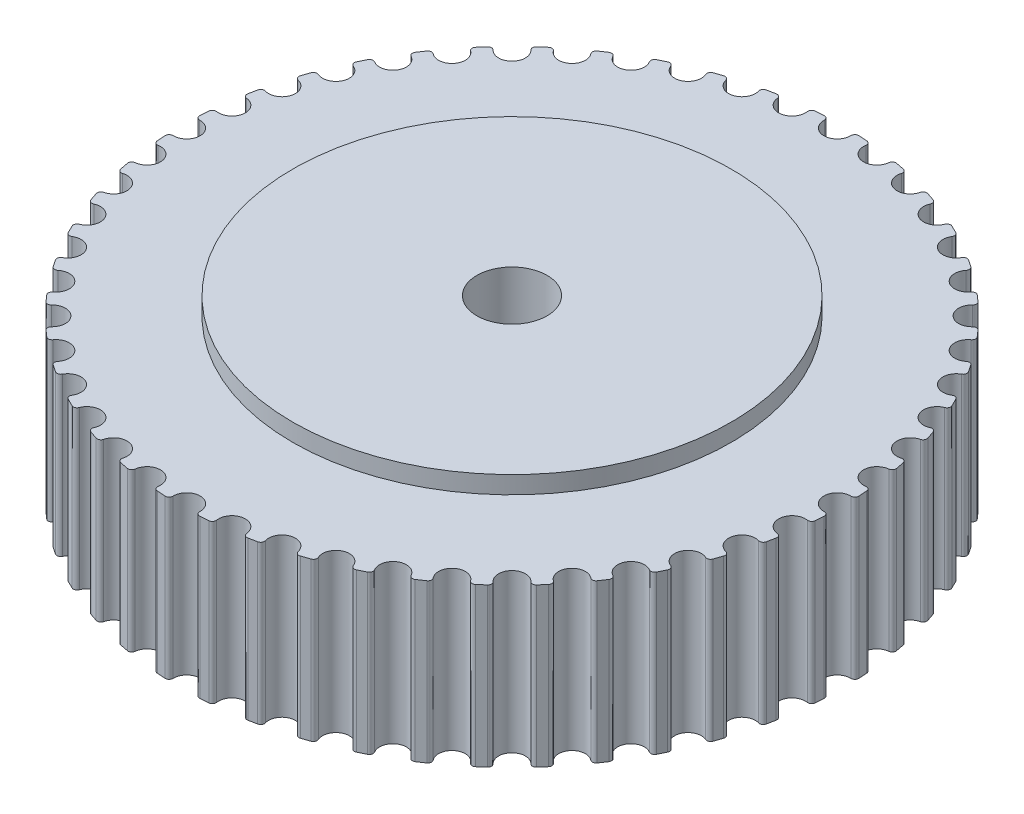
from build123d import *

# Parameters (mm, degrees)
AUFSATZ_LINEAR_AUSTRAGEN1_DEPTH = 18
SKIZZE5_R                       = 25
AUFSATZ_LINEAR_AUSTRAGEN2_DEPTH = 2
F_8_0_8_DURCHMESSER_BOHRUNG1_D  = 8
KREISMUSTER1_COUNT              = 3


with BuildPart() as part:
    # Skizze1 → Aufsatz-Linear austragen1 (new body)
    with BuildSketch(Plane(origin=(0, 0, 0), x_dir=(1, 0, 0), z_dir=(0, 1, 0))):
        with BuildLine():
            Line((1.98238775, 37.572704303), (2.938793876, 37.510018134))
            ThreePointArc((2.938793876, 37.510018134), (3.246775364, 37.349143087), (3.335291888, 37.013139809))
            ThreePointArc((3.335291888, 37.013139809), (3.618732929, 35.861010692), (4.642164026, 35.260736495))
            ThreePointArc((4.642164026, 35.260736495), (5.78608495, 35.575673386), (6.358060929, 36.615184715))
            ThreePointArc((6.358060929, 36.615184715), (6.530525373, 36.916829196), (6.869650172, 36.992511085))
            Line((6.869650172, 36.992511085), (7.809691924, 36.805525155))
            ThreePointArc((7.809691924, 36.805525155), (8.09404018, 36.605826765), (8.137942205, 36.261144317))
            ThreePointArc((8.137942205, 36.261144317), (8.268575342, 35.081875345), (9.204899339, 34.353152012))
            ThreePointArc((9.204899339, 34.353152012), (10.380141373, 34.516082932), (11.082907474, 35.472043251))
            ThreePointArc((11.082907474, 35.472043251), (11.293268967, 35.748595995), (11.639370975, 35.779365746))
            Line((11.639370975, 35.779365746), (12.546963978, 35.471279435))
            ThreePointArc((12.546963978, 35.471279435), (12.802813725, 35.236174598), (12.801350074, 34.888710592))
            ThreePointArc((12.801350074, 34.888710592), (12.776940138, 33.702479384), (13.610136272, 32.857775574))
            ThreePointArc((13.610136272, 32.857775574), (14.7965907, 32.865912729), (15.6181224, 33.721965292))
            ThreePointArc((15.6181224, 33.721965292), (15.862781598, 33.968694404), (16.209938914, 33.954025538))
            Line((16.209938914, 33.954025538), (17.069554, 33.530110291))
            ThreePointArc((17.069554, 33.530110291), (17.292527578, 33.263621714), (17.245723295, 32.919321356))
            ThreePointArc((17.245723295, 32.919321356), (17.066687946, 31.746424656), (17.7825, 30.800193486))
            ThreePointArc((17.7825, 30.800193486), (18.959866258, 30.653397648), (19.886106922, 31.394895158))
            ThreePointArc((19.886106922, 31.394895158), (20.160877638, 31.607579035), (20.503150303, 31.54772254))
            Line((20.503150303, 31.54772254), (21.30007922, 31.015231662))
            ThreePointArc((21.30007922, 31.015231662), (21.486361489, 30.721919041), (21.395017408, 30.386673404))
            ThreePointArc((21.395017408, 30.386673404), (21.064419992, 29.247179801), (21.650600223, 28.215611547))
            ThreePointArc((21.650600223, 28.215611547), (22.798733248, 27.916394434), (23.813834641, 28.530649663))
            ThreePointArc((23.813834641, 28.530649663), (24.114015471, 28.705649225), (24.445547107, 28.601629263))
            Line((24.445547107, 28.601629263), (25.166154179, 27.969673821))
            ThreePointArc((25.166154179, 27.969673821), (25.312557798, 27.654555815), (25.178236842, 27.334101046))
            ThreePointArc((25.178236842, 27.334101046), (24.701733971, 26.24750759), (25.148252673, 25.148252673))
            ThreePointArc((25.148252673, 25.148252673), (26.24750759, 24.701733971), (27.334101046, 25.178236842))
            ThreePointArc((27.334101046, 25.178236842), (27.654555815, 25.312557798), (27.969673821, 25.166154179))
            Line((27.969673821, 25.166154179), (28.601629263, 24.445547107))
            ThreePointArc((28.601629263, 24.445547107), (28.705649225, 24.114015471), (28.530649663, 23.813834641))
            ThreePointArc((28.530649663, 23.813834641), (27.916394434, 22.798733248), (28.215611547, 21.650600223))
            ThreePointArc((28.215611547, 21.650600223), (29.247179801, 21.064419992), (30.386673404, 21.395017408))
            ThreePointArc((30.386673404, 21.395017408), (30.721919041, 21.486361489), (31.015231662, 21.30007922))
            Line((31.015231662, 21.30007922), (31.54772254, 20.503150303))
            ThreePointArc((31.54772254, 20.503150303), (31.607579035, 20.160877638), (31.394895158, 19.886106922))
            ThreePointArc((31.394895158, 19.886106922), (30.653397648, 18.959866258), (30.800193486, 17.7825))
            ThreePointArc((30.800193486, 17.7825), (31.746424656, 17.066687946), (32.919321356, 17.245723295))
            ThreePointArc((32.919321356, 17.245723295), (33.263621714, 17.292527578), (33.530110291, 17.069554))
            Line((33.530110291, 17.069554), (33.954025538, 16.209938914))
            ThreePointArc((33.954025538, 16.209938914), (33.968694404, 15.862781598), (33.721965292, 15.6181224))
            ThreePointArc((33.721965292, 15.6181224), (32.865912729, 14.7965907), (32.857775574, 13.610136272))
            ThreePointArc((32.857775574, 13.610136272), (33.702479384, 12.776940138), (34.888710592, 12.801350074))
            ThreePointArc((34.888710592, 12.801350074), (35.236174598, 12.802813725), (35.471279435, 12.546963978))
            Line((35.471279435, 12.546963978), (35.779365746, 11.639370975))
            ThreePointArc((35.779365746, 11.639370975), (35.748595995, 11.293268967), (35.472043251, 11.082907474))
            ThreePointArc((35.472043251, 11.082907474), (34.516082932, 10.380141373), (34.353152012, 9.204899339))
            ThreePointArc((34.353152012, 9.204899339), (35.081875345, 8.268575342), (36.261144317, 8.137942205))
            ThreePointArc((36.261144317, 8.137942205), (36.605826765, 8.09404018), (36.805525155, 7.809691924))
            Line((36.805525155, 7.809691924), (36.992511085, 6.869650172))
            ThreePointArc((36.992511085, 6.869650172), (36.916829196, 6.530525373), (36.615184715, 6.358060929))
            ThreePointArc((36.615184715, 6.358060929), (35.575673386, 5.78608495), (35.260736495, 4.642164026))
            ThreePointArc((35.260736495, 4.642164026), (35.861010692, 3.618732929), (37.013139809, 3.335291888))
            ThreePointArc((37.013139809, 3.335291888), (37.349143087, 3.246775364), (37.510018134, 2.938793876))
            Line((37.510018134, 2.938793876), (37.572704303, 1.98238775))
            ThreePointArc((37.572704303, 1.98238775), (37.453405215, 1.656042679), (37.131830217, 1.524426198))
            ThreePointArc((37.131830217, 1.524426198), (36.026554205, 1.093027008), (35.565, 0))
            ThreePointArc((35.565, 0), (36.026554205, -1.093027008), (37.131830217, -1.524426198))
            ThreePointArc((37.131830217, -1.524426198), (37.453405215, -1.656042679), (37.572704303, -1.98238775))
            Line((37.572704303, -1.98238775), (37.510018134, -2.938793876))
            ThreePointArc((37.510018134, -2.938793876), (37.349143087, -3.246775364), (37.013139809, -3.335291888))
            ThreePointArc((37.013139809, -3.335291888), (35.861010692, -3.618732929), (35.260736495, -4.642164026))
            ThreePointArc((35.260736495, -4.642164026), (35.575673386, -5.78608495), (36.615184715, -6.358060929))
            ThreePointArc((36.615184715, -6.358060929), (36.916829196, -6.530525373), (36.992511085, -6.869650172))
            Line((36.992511085, -6.869650172), (36.805525155, -7.809691924))
            ThreePointArc((36.805525155, -7.809691924), (36.605826765, -8.09404018), (36.261144317, -8.137942205))
            ThreePointArc((36.261144317, -8.137942205), (35.081875345, -8.268575342), (34.353152012, -9.204899339))
            ThreePointArc((34.353152012, -9.204899339), (34.516082932, -10.380141373), (35.472043251, -11.082907474))
            ThreePointArc((35.472043251, -11.082907474), (35.748595995, -11.293268967), (35.779365746, -11.639370975))
            Line((35.779365746, -11.639370975), (35.471279435, -12.546963978))
            ThreePointArc((35.471279435, -12.546963978), (35.236174598, -12.802813725), (34.888710592, -12.801350074))
            ThreePointArc((34.888710592, -12.801350074), (33.702479384, -12.776940138), (32.857775574, -13.610136272))
            ThreePointArc((32.857775574, -13.610136272), (32.865912729, -14.7965907), (33.721965292, -15.6181224))
            ThreePointArc((33.721965292, -15.6181224), (33.968694404, -15.862781598), (33.954025538, -16.209938914))
            Line((33.954025538, -16.209938914), (33.530110291, -17.069554))
            ThreePointArc((33.530110291, -17.069554), (33.263621714, -17.292527578), (32.919321356, -17.245723295))
            ThreePointArc((32.919321356, -17.245723295), (31.746424656, -17.066687946), (30.800193486, -17.7825))
            ThreePointArc((30.800193486, -17.7825), (30.653397648, -18.959866258), (31.394895158, -19.886106922))
            ThreePointArc((31.394895158, -19.886106922), (31.607579035, -20.160877638), (31.54772254, -20.503150303))
            Line((31.54772254, -20.503150303), (31.015231662, -21.30007922))
            ThreePointArc((31.015231662, -21.30007922), (30.721919041, -21.486361489), (30.386673404, -21.395017408))
            ThreePointArc((30.386673404, -21.395017408), (29.247179801, -21.064419992), (28.215611547, -21.650600223))
            ThreePointArc((28.215611547, -21.650600223), (27.916394434, -22.798733248), (28.530649663, -23.813834641))
            ThreePointArc((28.530649663, -23.813834641), (28.705649225, -24.114015471), (28.601629263, -24.445547107))
            Line((28.601629263, -24.445547107), (27.969673821, -25.166154179))
            ThreePointArc((27.969673821, -25.166154179), (27.654555815, -25.312557798), (27.334101046, -25.178236842))
            ThreePointArc((27.334101046, -25.178236842), (26.24750759, -24.701733971), (25.148252673, -25.148252673))
            ThreePointArc((25.148252673, -25.148252673), (24.701733971, -26.24750759), (25.178236842, -27.334101046))
            ThreePointArc((25.178236842, -27.334101046), (25.312557798, -27.654555815), (25.166154179, -27.969673821))
            Line((25.166154179, -27.969673821), (24.445547107, -28.601629263))
            ThreePointArc((24.445547107, -28.601629263), (24.114015471, -28.705649225), (23.813834641, -28.530649663))
            ThreePointArc((23.813834641, -28.530649663), (22.798733248, -27.916394434), (21.650600223, -28.215611547))
            ThreePointArc((21.650600223, -28.215611547), (21.064419992, -29.247179801), (21.395017408, -30.386673404))
            ThreePointArc((21.395017408, -30.386673404), (21.486361489, -30.721919041), (21.30007922, -31.015231662))
            Line((21.30007922, -31.015231662), (20.503150303, -31.54772254))
            ThreePointArc((20.503150303, -31.54772254), (20.160877638, -31.607579035), (19.886106922, -31.394895158))
            ThreePointArc((19.886106922, -31.394895158), (18.959866258, -30.653397648), (17.7825, -30.800193486))
            ThreePointArc((17.7825, -30.800193486), (17.066687946, -31.746424656), (17.245723295, -32.919321356))
            ThreePointArc((17.245723295, -32.919321356), (17.292527578, -33.263621714), (17.069554, -33.530110291))
            Line((17.069554, -33.530110291), (16.209938914, -33.954025538))
            ThreePointArc((16.209938914, -33.954025538), (15.862781598, -33.968694404), (15.6181224, -33.721965292))
            ThreePointArc((15.6181224, -33.721965292), (14.7965907, -32.865912729), (13.610136272, -32.857775574))
            ThreePointArc((13.610136272, -32.857775574), (12.776940138, -33.702479384), (12.801350074, -34.888710592))
            ThreePointArc((12.801350074, -34.888710592), (12.802813725, -35.236174598), (12.546963978, -35.471279435))
            Line((12.546963978, -35.471279435), (11.639370975, -35.779365746))
            ThreePointArc((11.639370975, -35.779365746), (11.293268967, -35.748595995), (11.082907474, -35.472043251))
            ThreePointArc((11.082907474, -35.472043251), (10.380141373, -34.516082932), (9.204899339, -34.353152012))
            ThreePointArc((9.204899339, -34.353152012), (8.268575342, -35.081875345), (8.137942205, -36.261144317))
            ThreePointArc((8.137942205, -36.261144317), (8.09404018, -36.605826765), (7.809691924, -36.805525155))
            Line((7.809691924, -36.805525155), (6.869650172, -36.992511085))
            ThreePointArc((6.869650172, -36.992511085), (6.530525373, -36.916829196), (6.358060929, -36.615184715))
            ThreePointArc((6.358060929, -36.615184715), (5.78608495, -35.575673386), (4.642164026, -35.260736495))
            ThreePointArc((4.642164026, -35.260736495), (3.618732929, -35.861010692), (3.335291888, -37.013139809))
            ThreePointArc((3.335291888, -37.013139809), (3.246775364, -37.349143087), (2.938793876, -37.510018134))
            Line((2.938793876, -37.510018134), (1.98238775, -37.572704303))
            ThreePointArc((1.98238775, -37.572704303), (1.656042679, -37.453405215), (1.524426198, -37.131830217))
            ThreePointArc((1.524426198, -37.131830217), (1.093027008, -36.026554205), (0, -35.565))
            ThreePointArc((0, -35.565), (-1.093027008, -36.026554205), (-1.524426198, -37.131830217))
            ThreePointArc((-1.524426198, -37.131830217), (-1.656042679, -37.453405215), (-1.98238775, -37.572704303))
            Line((-1.98238775, -37.572704303), (-2.938793876, -37.510018134))
            ThreePointArc((-2.938793876, -37.510018134), (-3.246775364, -37.349143087), (-3.335291888, -37.013139809))
            ThreePointArc((-3.335291888, -37.013139809), (-3.618732929, -35.861010692), (-4.642164026, -35.260736495))
            ThreePointArc((-4.642164026, -35.260736495), (-5.78608495, -35.575673386), (-6.358060929, -36.615184715))
            ThreePointArc((-6.358060929, -36.615184715), (-6.530525373, -36.916829196), (-6.869650172, -36.992511085))
            Line((-6.869650172, -36.992511085), (-7.809691924, -36.805525155))
            ThreePointArc((-7.809691924, -36.805525155), (-8.09404018, -36.605826765), (-8.137942205, -36.261144317))
            ThreePointArc((-8.137942205, -36.261144317), (-8.268575342, -35.081875345), (-9.204899339, -34.353152012))
            ThreePointArc((-9.204899339, -34.353152012), (-10.380141373, -34.516082932), (-11.082907474, -35.472043251))
            ThreePointArc((-11.082907474, -35.472043251), (-11.293268967, -35.748595995), (-11.639370975, -35.779365746))
            Line((-11.639370975, -35.779365746), (-12.546963978, -35.471279435))
            ThreePointArc((-12.546963978, -35.471279435), (-12.802813725, -35.236174598), (-12.801350074, -34.888710592))
            ThreePointArc((-12.801350074, -34.888710592), (-12.776940138, -33.702479384), (-13.610136272, -32.857775574))
            ThreePointArc((-13.610136272, -32.857775574), (-14.7965907, -32.865912729), (-15.6181224, -33.721965292))
            ThreePointArc((-15.6181224, -33.721965292), (-15.862781598, -33.968694404), (-16.209938914, -33.954025538))
            Line((-16.209938914, -33.954025538), (-17.069554, -33.530110291))
            ThreePointArc((-17.069554, -33.530110291), (-17.292527578, -33.263621714), (-17.245723295, -32.919321356))
            ThreePointArc((-17.245723295, -32.919321356), (-17.066687946, -31.746424656), (-17.7825, -30.800193486))
            ThreePointArc((-17.7825, -30.800193486), (-18.959866258, -30.653397648), (-19.886106922, -31.394895158))
            ThreePointArc((-19.886106922, -31.394895158), (-20.160877638, -31.607579035), (-20.503150303, -31.54772254))
            Line((-20.503150303, -31.54772254), (-21.30007922, -31.015231662))
            ThreePointArc((-21.30007922, -31.015231662), (-21.486361489, -30.721919041), (-21.395017408, -30.386673404))
            ThreePointArc((-21.395017408, -30.386673404), (-21.064419992, -29.247179801), (-21.650600223, -28.215611547))
            ThreePointArc((-21.650600223, -28.215611547), (-22.798733248, -27.916394434), (-23.813834641, -28.530649663))
            ThreePointArc((-23.813834641, -28.530649663), (-24.114015471, -28.705649225), (-24.445547107, -28.601629263))
            Line((-24.445547107, -28.601629263), (-25.166154179, -27.969673821))
            ThreePointArc((-25.166154179, -27.969673821), (-25.312557798, -27.654555815), (-25.178236842, -27.334101046))
            ThreePointArc((-25.178236842, -27.334101046), (-24.701733971, -26.24750759), (-25.148252673, -25.148252673))
            ThreePointArc((-25.148252673, -25.148252673), (-26.24750759, -24.701733971), (-27.334101046, -25.178236842))
            ThreePointArc((-27.334101046, -25.178236842), (-27.654555815, -25.312557798), (-27.969673821, -25.166154179))
            Line((-27.969673821, -25.166154179), (-28.601629263, -24.445547107))
            ThreePointArc((-28.601629263, -24.445547107), (-28.705649225, -24.114015471), (-28.530649663, -23.813834641))
            ThreePointArc((-28.530649663, -23.813834641), (-27.916394434, -22.798733248), (-28.215611547, -21.650600223))
            ThreePointArc((-28.215611547, -21.650600223), (-29.247179801, -21.064419992), (-30.386673404, -21.395017408))
            ThreePointArc((-30.386673404, -21.395017408), (-30.721919041, -21.486361489), (-31.015231662, -21.30007922))
            Line((-31.015231662, -21.30007922), (-31.54772254, -20.503150303))
            ThreePointArc((-31.54772254, -20.503150303), (-31.607579035, -20.160877638), (-31.394895158, -19.886106922))
            ThreePointArc((-31.394895158, -19.886106922), (-30.653397648, -18.959866258), (-30.800193486, -17.7825))
            ThreePointArc((-30.800193486, -17.7825), (-31.746424656, -17.066687946), (-32.919321356, -17.245723295))
            ThreePointArc((-32.919321356, -17.245723295), (-33.263621714, -17.292527578), (-33.530110291, -17.069554))
            Line((-33.530110291, -17.069554), (-33.954025538, -16.209938914))
            ThreePointArc((-33.954025538, -16.209938914), (-33.968694404, -15.862781598), (-33.721965292, -15.6181224))
            ThreePointArc((-33.721965292, -15.6181224), (-32.865912729, -14.7965907), (-32.857775574, -13.610136272))
            ThreePointArc((-32.857775574, -13.610136272), (-33.702479384, -12.776940138), (-34.888710592, -12.801350074))
            ThreePointArc((-34.888710592, -12.801350074), (-35.236174598, -12.802813725), (-35.471279435, -12.546963978))
            Line((-35.471279435, -12.546963978), (-35.779365746, -11.639370975))
            ThreePointArc((-35.779365746, -11.639370975), (-35.748595995, -11.293268967), (-35.472043251, -11.082907474))
            ThreePointArc((-35.472043251, -11.082907474), (-34.516082932, -10.380141373), (-34.353152012, -9.204899339))
            ThreePointArc((-34.353152012, -9.204899339), (-35.081875345, -8.268575342), (-36.261144317, -8.137942205))
            ThreePointArc((-36.261144317, -8.137942205), (-36.605826765, -8.09404018), (-36.805525155, -7.809691924))
            Line((-36.805525155, -7.809691924), (-36.992511085, -6.869650172))
            ThreePointArc((-36.992511085, -6.869650172), (-36.916829196, -6.530525373), (-36.615184715, -6.358060929))
            ThreePointArc((-36.615184715, -6.358060929), (-35.575673386, -5.78608495), (-35.260736495, -4.642164026))
            ThreePointArc((-35.260736495, -4.642164026), (-35.861010692, -3.618732929), (-37.013139809, -3.335291888))
            ThreePointArc((-37.013139809, -3.335291888), (-37.349143087, -3.246775364), (-37.510018134, -2.938793876))
            Line((-37.510018134, -2.938793876), (-37.572704303, -1.98238775))
            ThreePointArc((-37.572704303, -1.98238775), (-37.453405215, -1.656042679), (-37.131830217, -1.524426198))
            ThreePointArc((-37.131830217, -1.524426198), (-36.026554205, -1.093027008), (-35.565, 0))
            ThreePointArc((-35.565, 0), (-36.026554205, 1.093027008), (-37.131830217, 1.524426198))
            ThreePointArc((-37.131830217, 1.524426198), (-37.453405215, 1.656042679), (-37.572704303, 1.98238775))
            Line((-37.572704303, 1.98238775), (-37.510018134, 2.938793876))
            ThreePointArc((-37.510018134, 2.938793876), (-37.349143087, 3.246775364), (-37.013139809, 3.335291888))
            ThreePointArc((-37.013139809, 3.335291888), (-35.861010692, 3.618732929), (-35.260736495, 4.642164026))
            ThreePointArc((-35.260736495, 4.642164026), (-35.575673386, 5.78608495), (-36.615184715, 6.358060929))
            ThreePointArc((-36.615184715, 6.358060929), (-36.916829196, 6.530525373), (-36.992511085, 6.869650172))
            Line((-36.992511085, 6.869650172), (-36.805525155, 7.809691924))
            ThreePointArc((-36.805525155, 7.809691924), (-36.605826765, 8.09404018), (-36.261144317, 8.137942205))
            ThreePointArc((-36.261144317, 8.137942205), (-35.081875345, 8.268575342), (-34.353152012, 9.204899339))
            ThreePointArc((-34.353152012, 9.204899339), (-34.516082932, 10.380141373), (-35.472043251, 11.082907474))
            ThreePointArc((-35.472043251, 11.082907474), (-35.748595995, 11.293268967), (-35.779365746, 11.639370975))
            Line((-35.779365746, 11.639370975), (-35.471279435, 12.546963978))
            ThreePointArc((-35.471279435, 12.546963978), (-35.236174598, 12.802813725), (-34.888710592, 12.801350074))
            ThreePointArc((-34.888710592, 12.801350074), (-33.702479384, 12.776940138), (-32.857775574, 13.610136272))
            ThreePointArc((-32.857775574, 13.610136272), (-32.865912729, 14.7965907), (-33.721965292, 15.6181224))
            ThreePointArc((-33.721965292, 15.6181224), (-33.968694404, 15.862781598), (-33.954025538, 16.209938914))
            Line((-33.954025538, 16.209938914), (-33.530110291, 17.069554))
            ThreePointArc((-33.530110291, 17.069554), (-33.263621714, 17.292527578), (-32.919321356, 17.245723295))
            ThreePointArc((-32.919321356, 17.245723295), (-31.746424656, 17.066687946), (-30.800193486, 17.7825))
            ThreePointArc((-30.800193486, 17.7825), (-30.653397648, 18.959866258), (-31.394895158, 19.886106922))
            ThreePointArc((-31.394895158, 19.886106922), (-31.607579035, 20.160877638), (-31.54772254, 20.503150303))
            Line((-31.54772254, 20.503150303), (-31.015231662, 21.30007922))
            ThreePointArc((-31.015231662, 21.30007922), (-30.721919041, 21.486361489), (-30.386673404, 21.395017408))
            ThreePointArc((-30.386673404, 21.395017408), (-29.247179801, 21.064419992), (-28.215611547, 21.650600223))
            ThreePointArc((-28.215611547, 21.650600223), (-27.916394434, 22.798733248), (-28.530649663, 23.813834641))
            ThreePointArc((-28.530649663, 23.813834641), (-28.705649225, 24.114015471), (-28.601629263, 24.445547107))
            Line((-28.601629263, 24.445547107), (-27.969673821, 25.166154179))
            ThreePointArc((-27.969673821, 25.166154179), (-27.654555815, 25.312557798), (-27.334101046, 25.178236842))
            ThreePointArc((-27.334101046, 25.178236842), (-26.24750759, 24.701733971), (-25.148252673, 25.148252673))
            ThreePointArc((-25.148252673, 25.148252673), (-24.701733971, 26.24750759), (-25.178236842, 27.334101046))
            ThreePointArc((-25.178236842, 27.334101046), (-25.312557798, 27.654555815), (-25.166154179, 27.969673821))
            Line((-25.166154179, 27.969673821), (-24.445547107, 28.601629263))
            ThreePointArc((-24.445547107, 28.601629263), (-24.114015471, 28.705649225), (-23.813834641, 28.530649663))
            ThreePointArc((-23.813834641, 28.530649663), (-22.798733248, 27.916394434), (-21.650600223, 28.215611547))
            ThreePointArc((-21.650600223, 28.215611547), (-21.064419992, 29.247179801), (-21.395017408, 30.386673404))
            ThreePointArc((-21.395017408, 30.386673404), (-21.486361489, 30.721919041), (-21.30007922, 31.015231662))
            Line((-21.30007922, 31.015231662), (-20.503150303, 31.54772254))
            ThreePointArc((-20.503150303, 31.54772254), (-20.160877638, 31.607579035), (-19.886106922, 31.394895158))
            ThreePointArc((-19.886106922, 31.394895158), (-18.959866258, 30.653397648), (-17.7825, 30.800193486))
            ThreePointArc((-17.7825, 30.800193486), (-17.066687946, 31.746424656), (-17.245723295, 32.919321356))
            ThreePointArc((-17.245723295, 32.919321356), (-17.292527578, 33.263621714), (-17.069554, 33.530110291))
            Line((-17.069554, 33.530110291), (-16.209938914, 33.954025538))
            ThreePointArc((-16.209938914, 33.954025538), (-15.862781598, 33.968694404), (-15.6181224, 33.721965292))
            ThreePointArc((-15.6181224, 33.721965292), (-14.7965907, 32.865912729), (-13.610136272, 32.857775574))
            ThreePointArc((-13.610136272, 32.857775574), (-12.776940138, 33.702479384), (-12.801350074, 34.888710592))
            ThreePointArc((-12.801350074, 34.888710592), (-12.802813725, 35.236174598), (-12.546963978, 35.471279435))
            Line((-12.546963978, 35.471279435), (-11.639370975, 35.779365746))
            ThreePointArc((-11.639370975, 35.779365746), (-11.293268967, 35.748595995), (-11.082907474, 35.472043251))
            ThreePointArc((-11.082907474, 35.472043251), (-10.380141373, 34.516082932), (-9.204899339, 34.353152012))
            ThreePointArc((-9.204899339, 34.353152012), (-8.268575342, 35.081875345), (-8.137942205, 36.261144317))
            ThreePointArc((-8.137942205, 36.261144317), (-8.09404018, 36.605826765), (-7.809691924, 36.805525155))
            Line((-7.809691924, 36.805525155), (-6.869650172, 36.992511085))
            ThreePointArc((-6.869650172, 36.992511085), (-6.530525373, 36.916829196), (-6.358060929, 36.615184715))
            ThreePointArc((-6.358060929, 36.615184715), (-5.78608495, 35.575673386), (-4.642164026, 35.260736495))
            ThreePointArc((-4.642164026, 35.260736495), (-3.618732929, 35.861010692), (-3.335291888, 37.013139809))
            ThreePointArc((-3.335291888, 37.013139809), (-3.246775364, 37.349143087), (-2.938793876, 37.510018134))
            Line((-2.938793876, 37.510018134), (-1.98238775, 37.572704303))
            ThreePointArc((-1.98238775, 37.572704303), (-1.656042679, 37.453405215), (-1.524426198, 37.131830217))
            ThreePointArc((-1.524426198, 37.131830217), (-1.093027008, 36.026554205), (0, 35.565))
            ThreePointArc((0, 35.565), (1.093027008, 36.026554205), (1.524426198, 37.131830217))
            ThreePointArc((1.524426198, 37.131830217), (1.656042679, 37.453405215), (1.98238775, 37.572704303))
        make_face()
    extrude(amount=AUFSATZ_LINEAR_AUSTRAGEN1_DEPTH)

    # Skizze5 → Aufsatz-Linear austragen2 (add)
    with BuildSketch(Plane(origin=(0, 18, 0), x_dir=(1, 0, 0), z_dir=(0, 1, 0))):
        Circle(SKIZZE5_R)
    extrude(amount=AUFSATZ_LINEAR_AUSTRAGEN2_DEPTH)

    # Skizze6 → Rotation1 (revolve)
    with BuildSketch(Plane.XY):
        Polygon((0, -12), (12, -12), (12, -2), (25, -2), (25, 0), (0, 0), align=None)
    revolve(axis=Axis((0, 0, 0), (0, -1, 0)))

    # Ø8.0 (8) Durchmesser Bohrung1 (through all)
    with Locations(Plane(origin=(0, 20, 0), x_dir=(1, 0, 0), z_dir=(0, 1, 0))):
        with Locations((0, 0)):
            Hole(F_8_0_8_DURCHMESSER_BOHRUNG1_D / 2)

    # Skizze10 → Ø3.1 (3.1) Durchmesser Bohrung1 (revolve, cut)
    with BuildSketch(Plane.ZX.offset(-7)):
        Polygon((0, 0), (0, 17.931333959), (1.55, 17), (1.55, 0), align=None)
    f_3_1_3_1_durchmesser_bohrung1 = revolve(axis=Axis((-6.35, -7, 0), (1, 0, 0)), mode=Mode.SUBTRACT)

    # Kreismuster1: Ø3.1 (3.1) Durchmesser Bohrung1 ×3 about axis
    kreismuster1_axis = Axis((0, 0, 0), (0, 1, 0))
    for i in range(1, KREISMUSTER1_COUNT):
        add(f_3_1_3_1_durchmesser_bohrung1.rotate(kreismuster1_axis, i * 360 / KREISMUSTER1_COUNT), mode=Mode.SUBTRACT)


solid = part.part
